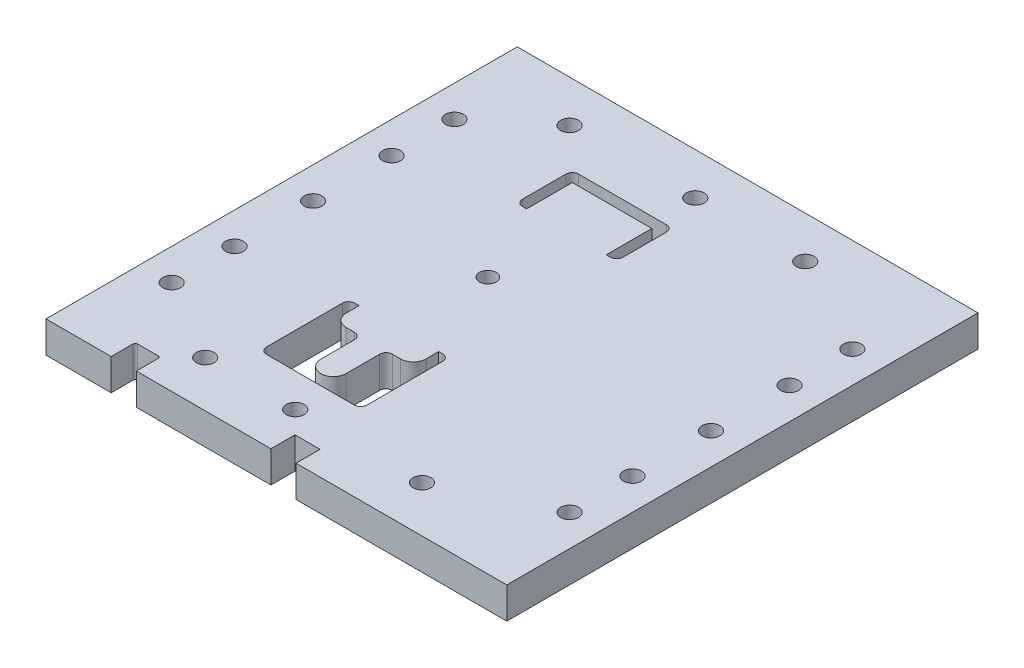
from build123d import *

# Parameters (mm, degrees)
SKETCH1_W           = 220
SKETCH1_H           = 225
BOSS_EXTRUDE1_DEPTH = 15
CUT_EXTRUDE1_REACH  = 160.055
SKETCH2_R           = 4
CUT_EXTRUDE2_REACH  = 160.055
SKETCH3_W           = 12
SKETCH3_H           = 11.5
SKETCH4_R           = 8.5
CUT_EXTRUDE3_DEPTH  = 5
M10_TAPPED_HOLE2_D  = 8.5
M10_TAPPED_HOLE3_D  = 8.5
M10_TAPPED_HOLE4_D  = 8.5
CUT_EXTRUDE4_REACH  = 160.055
CUT_EXTRUDE6_REACH  = 160.055


with BuildPart() as part:
    # Sketch1 → Boss-Extrude1 (new body)
    with BuildSketch(Plane(origin=(0, 0, 0), x_dir=(1, 0, 0), z_dir=(0, 1, 0))):
        Rectangle(SKETCH1_W, SKETCH1_H)
    extrude(amount=-BOSS_EXTRUDE1_DEPTH)

    # Sketch2 → Cut-Extrude1 (cut, up to next)
    with BuildSketch(Plane(origin=(0, 0, 0), x_dir=(1, 0, 0), z_dir=(0, 1, 0)), mode=Mode.PRIVATE) as cut_extrude1_sk1:
        with Locations((-21.75, 10.23)):
            Circle(SKETCH2_R)
    cut_extrude1_tool1 = extrude(cut_extrude1_sk1.sketch, amount=-CUT_EXTRUDE1_REACH, mode=Mode.PRIVATE) & part.part
    add(cut_extrude1_tool1.solids().sort_by_distance((-21.75, 0, -10.23))[0], mode=Mode.SUBTRACT)

    # Sketch3 → Cut-Extrude2 (cut, up to next)
    with BuildSketch(Plane.XZ.offset(15), mode=Mode.PRIVATE) as cut_extrude2_sk1:
        with BuildLine():
            Line((-77.87, 101), (-67.87, 101))
            ThreePointArc((-67.87, 101), (-67.162893219, 101.292893219), (-66.87, 102))
            Line((-66.87, 102), (-66.87, 112.5))
            Line((-66.87, 112.5), (-78.87, 112.5))
            Line((-78.87, 112.5), (-78.87, 102))
            ThreePointArc((-78.87, 102), (-78.577106781, 101.292893219), (-77.87, 101))
        make_face()
    cut_extrude2_tool1 = extrude(cut_extrude2_sk1.sketch, amount=-CUT_EXTRUDE2_REACH, mode=Mode.PRIVATE) & part.part
    # Sketch3 → Cut-Extrude2 (cut, up to next)
    with BuildSketch(Plane.XZ.offset(15), mode=Mode.PRIVATE) as cut_extrude2_sk2:
        with Locations((3.38, 106.75)):
            Rectangle(SKETCH3_W, SKETCH3_H)
    cut_extrude2_tool2 = extrude(cut_extrude2_sk2.sketch, amount=-CUT_EXTRUDE2_REACH, mode=Mode.PRIVATE) & part.part
    add(cut_extrude2_tool1.solids().sort_by_distance((-72.87, -15, 106.767242))[0], mode=Mode.SUBTRACT)
    add(cut_extrude2_tool2.solids().sort_by_distance((3.38, -15, 106.75))[0], mode=Mode.SUBTRACT)

    # Sketch4 → Cut-Extrude3 (cut)
    with BuildSketch(Plane.XZ.offset(15)):
        with Locations((-35, 100)):
            Circle(SKETCH4_R)
        with Locations((25, 100)):
            Circle(SKETCH4_R)
        with Locations((70, 100)):
            Circle(SKETCH4_R)
        with Locations((-35, -100)):
            Circle(SKETCH4_R)
        with Locations((25, -100)):
            Circle(SKETCH4_R)
        with Locations((70, -100)):
            Circle(SKETCH4_R)
    extrude(amount=-CUT_EXTRUDE3_DEPTH, mode=Mode.SUBTRACT)

    # M10 Tapped Hole2 (through all)
    with Locations(Plane(origin=(0, 0, 0), x_dir=(1, 0, 0), z_dir=(0, 1, 0))):
        with Locations((-95, -67.5), (-95, -37.5), (-95, 0), (-95, 37.5), (-95, 67.5), (95, 67.5), (95, 37.5), (95, 0), (95, -37.5), (95, -67.5)):
            Hole(M10_TAPPED_HOLE2_D / 2)

    # M10 Tapped Hole3 (through all)
    with Locations(Plane(origin=(0, 0, 0), x_dir=(1, 0, 0), z_dir=(0, 1, 0))):
        with Locations((-65, 92.5), (-5, 92.5), (47.5, 92.5)):
            Hole(M10_TAPPED_HOLE3_D / 2)

    # M10 Tapped Hole4 (through all)
    with Locations(Plane(origin=(0, 0, 0), x_dir=(1, 0, 0), z_dir=(0, 1, 0))):
        with Locations((-13, -90.5), (47.5, -90.5), (-56, -90.5)):
            Hole(M10_TAPPED_HOLE4_D / 2)

    # Sketch24 → Cut-Extrude4 (cut, up to next)
    with BuildSketch(Plane(origin=(0, 0, 0), x_dir=(1, 0, 0), z_dir=(0, 1, 0)), mode=Mode.PRIVATE) as cut_extrude4_sk1:
        with BuildLine():
            Line((2.25, -35.27), (2.25, -71.53))
            ThreePointArc((2.25, -71.53), (1.371320344, -73.651320344), (-0.75, -74.53))
            Line((-0.75, -74.53), (-42.75, -74.53))
            ThreePointArc((-42.75, -74.53), (-44.871320344, -73.651320344), (-45.75, -71.53))
            Line((-45.75, -71.53), (-45.75, -35.27))
            ThreePointArc((-45.75, -35.27), (-44.871320344, -33.148679656), (-42.75, -32.27))
            Line((-42.75, -32.27), (-40.75, -32.27))
            Line((-40.75, -32.27), (-40.75, -38.4))
            ThreePointArc((-40.75, -38.4), (-38.992640687, -42.642640687), (-34.75, -44.4))
            Line((-34.75, -44.4), (-30.75, -44.4))
            ThreePointArc((-30.75, -44.4), (-28.628679656, -45.278679656), (-27.75, -47.4))
            Line((-27.75, -47.4), (-27.75, -63.53))
            ThreePointArc((-27.75, -63.53), (-21.75, -69.53), (-15.75, -63.53))
            Line((-15.75, -63.53), (-15.75, -47.4))
            ThreePointArc((-15.75, -47.4), (-14.871320344, -45.278679656), (-12.75, -44.4))
            Line((-12.75, -44.4), (-8.75, -44.4))
            ThreePointArc((-8.75, -44.4), (-4.507359313, -42.642640687), (-2.75, -38.4))
            Line((-2.75, -38.4), (-2.75, -32.27))
            Line((-2.75, -32.27), (-0.75, -32.27))
            ThreePointArc((-0.75, -32.27), (1.371320344, -33.148679656), (2.25, -35.27))
        make_face()
    cut_extrude4_tool1 = extrude(cut_extrude4_sk1.sketch, amount=-CUT_EXTRUDE4_REACH, mode=Mode.PRIVATE) & part.part
    add(cut_extrude4_tool1.solids().sort_by_distance((-15.110476, 0, 55.465))[0], mode=Mode.SUBTRACT)

    # Sketch29 → Cut-Extrude6 (cut, up to next)
    with BuildSketch(Plane.XZ.offset(15), mode=Mode.PRIVATE) as cut_extrude6_sk1:
        with BuildLine():
            Line((-2.75, -47.73), (-0.75, -47.73))
            ThreePointArc((-0.75, -47.73), (1.371320344, -48.608679656), (2.25, -50.73))
            Line((2.25, -50.73), (2.25, -71.53))
            ThreePointArc((2.25, -71.53), (1.371320344, -73.651320344), (-0.75, -74.53))
            Line((-0.75, -74.53), (-42.75, -74.53))
            ThreePointArc((-42.75, -74.53), (-44.871320344, -73.651320344), (-45.75, -71.53))
            Line((-45.75, -71.53), (-45.75, -50.73))
            ThreePointArc((-45.75, -50.73), (-44.871320344, -48.608679656), (-42.75, -47.73))
            Line((-42.75, -47.73), (-40.75, -47.73))
            Line((-40.75, -47.73), (-40.75, -69.53))
            Line((-40.75, -69.53), (-2.75, -69.53))
            Line((-2.75, -69.53), (-2.75, -47.73))
        make_face()
    cut_extrude6_tool1 = extrude(cut_extrude6_sk1.sketch, amount=-CUT_EXTRUDE6_REACH, mode=Mode.PRIVATE) & part.part
    add(cut_extrude6_tool1.solids().sort_by_distance((-1.75, -15, -48.279749))[0], mode=Mode.SUBTRACT)


solid = part.part
